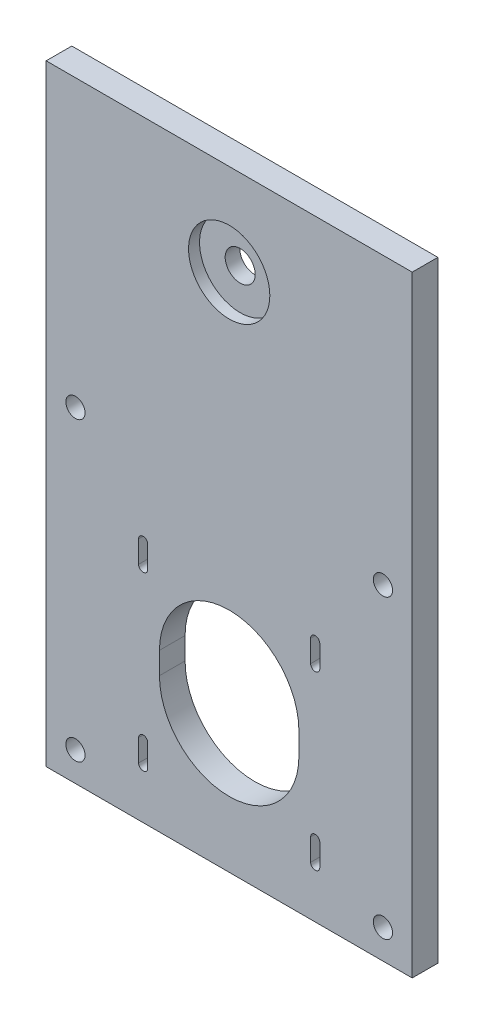
from build123d import *

# Parameters (mm, degrees)
SKETCH1_W           = 100
SKETCH1_H           = 247
SKETCH1_R           = 2.625
SKETCH1_R_2         = 4.1
BOSS_EXTRUDE1_DEPTH = 7
SKETCH2_R           = 11.1
CUT_EXTRUDE1_DEPTH  = 3
CUT_EXTRUDE2_DEPTH  = 3
SKETCH4_W           = 100
SKETCH4_H           = 80
CUT_EXTRUDE3_DEPTH  = 134.421325132


with BuildPart() as part:
    # Sketch1 → Boss-Extrude1 (new body)
    with BuildSketch(Plane.XY):
        Rectangle(SKETCH1_W, SKETCH1_H)
        with Locations((-42, -34.5)):
            Circle(SKETCH1_R, mode=Mode.SUBTRACT)
        with Locations((42, -34.5)):
            Circle(SKETCH1_R, mode=Mode.SUBTRACT)
        with Locations((-42, -115.5)):
            Circle(SKETCH1_R, mode=Mode.SUBTRACT)
        with Locations((42, -115.5)):
            Circle(SKETCH1_R, mode=Mode.SUBTRACT)
        with Locations((0, 18.5)):
            Circle(SKETCH1_R_2, mode=Mode.SUBTRACT)
        with Locations((42, 115.5)):
            Circle(SKETCH1_R, mode=Mode.SUBTRACT)
        with Locations((-42, 115.5)):
            Circle(SKETCH1_R, mode=Mode.SUBTRACT)
        with BuildLine():
            Line((-19.05, -80.5), (-19.05, -86.5))
            ThreePointArc((-19.05, -86.5), (0, -105.55), (19.05, -86.5))
            Line((19.05, -86.5), (19.05, -80.5))
            ThreePointArc((19.05, -80.5), (0, -61.45), (-19.05, -80.5))
        make_face(mode=Mode.SUBTRACT)
        with BuildLine():
            Line((-22.25, -57), (-22.25, -63))
            ThreePointArc((-22.25, -63), (-23.5, -64.25), (-24.75, -63))
            Line((-24.75, -63), (-24.75, -57))
            ThreePointArc((-24.75, -57), (-23.5, -55.75), (-22.25, -57))
        make_face(mode=Mode.SUBTRACT)
        with BuildLine():
            Line((22.25, -57), (22.25, -63))
            ThreePointArc((22.25, -63), (23.5, -64.25), (24.75, -63))
            Line((24.75, -63), (24.75, -57))
            ThreePointArc((24.75, -57), (23.5, -55.75), (22.25, -57))
        make_face(mode=Mode.SUBTRACT)
        with BuildLine():
            Line((22.25, -110), (22.25, -104))
            ThreePointArc((22.25, -104), (23.5, -102.75), (24.75, -104))
            Line((24.75, -104), (24.75, -110))
            ThreePointArc((24.75, -110), (23.5, -111.25), (22.25, -110))
        make_face(mode=Mode.SUBTRACT)
        with BuildLine():
            Line((-22.25, -110), (-22.25, -104))
            ThreePointArc((-22.25, -104), (-23.5, -102.75), (-24.75, -104))
            Line((-24.75, -104), (-24.75, -110))
            ThreePointArc((-24.75, -110), (-23.5, -111.25), (-22.25, -110))
        make_face(mode=Mode.SUBTRACT)
    extrude(amount=BOSS_EXTRUDE1_DEPTH)

    # Sketch2 → Cut-Extrude1 (cut)
    with BuildSketch(Plane.XY.offset(7)):
        with Locations((0, 18.5)):
            Circle(SKETCH2_R)
    extrude(amount=-CUT_EXTRUDE1_DEPTH, mode=Mode.SUBTRACT)

    # Sketch3 → Cut-Extrude2 (cut)
    with BuildSketch(Plane.XY):
        with BuildLine():
            Line((-25.5, -63), (-25.5, -57))
            ThreePointArc((-25.5, -57), (-23.5, -55), (-21.5, -57))
            Line((-21.5, -57), (-21.5, -63))
            ThreePointArc((-21.5, -63), (-23.5, -65), (-25.5, -63))
        make_face()
        with BuildLine():
            Line((21.5, -63), (21.5, -57))
            ThreePointArc((21.5, -57), (23.5, -55), (25.5, -57))
            Line((25.5, -57), (25.5, -63))
            ThreePointArc((25.5, -63), (23.5, -65), (21.5, -63))
        make_face()
        with BuildLine():
            Line((-25.5, -110), (-25.5, -104))
            ThreePointArc((-25.5, -104), (-23.5, -102), (-21.5, -104))
            Line((-21.5, -104), (-21.5, -110))
            ThreePointArc((-21.5, -110), (-23.5, -112), (-25.5, -110))
        make_face()
        with BuildLine():
            Line((21.5, -110), (21.5, -104))
            ThreePointArc((21.5, -104), (23.5, -102), (25.5, -104))
            Line((25.5, -104), (25.5, -110))
            ThreePointArc((25.5, -110), (23.5, -112), (21.5, -110))
        make_face()
    extrude(amount=CUT_EXTRUDE2_DEPTH, mode=Mode.SUBTRACT)

    # Sketch4 → Cut-Extrude3 (cut, through all)
    with BuildSketch(Plane.XY.offset(7)):
        with Locations((0, 83.5)):
            Rectangle(SKETCH4_W, SKETCH4_H)
    extrude(amount=-CUT_EXTRUDE3_DEPTH, mode=Mode.SUBTRACT)


solid = part.part
